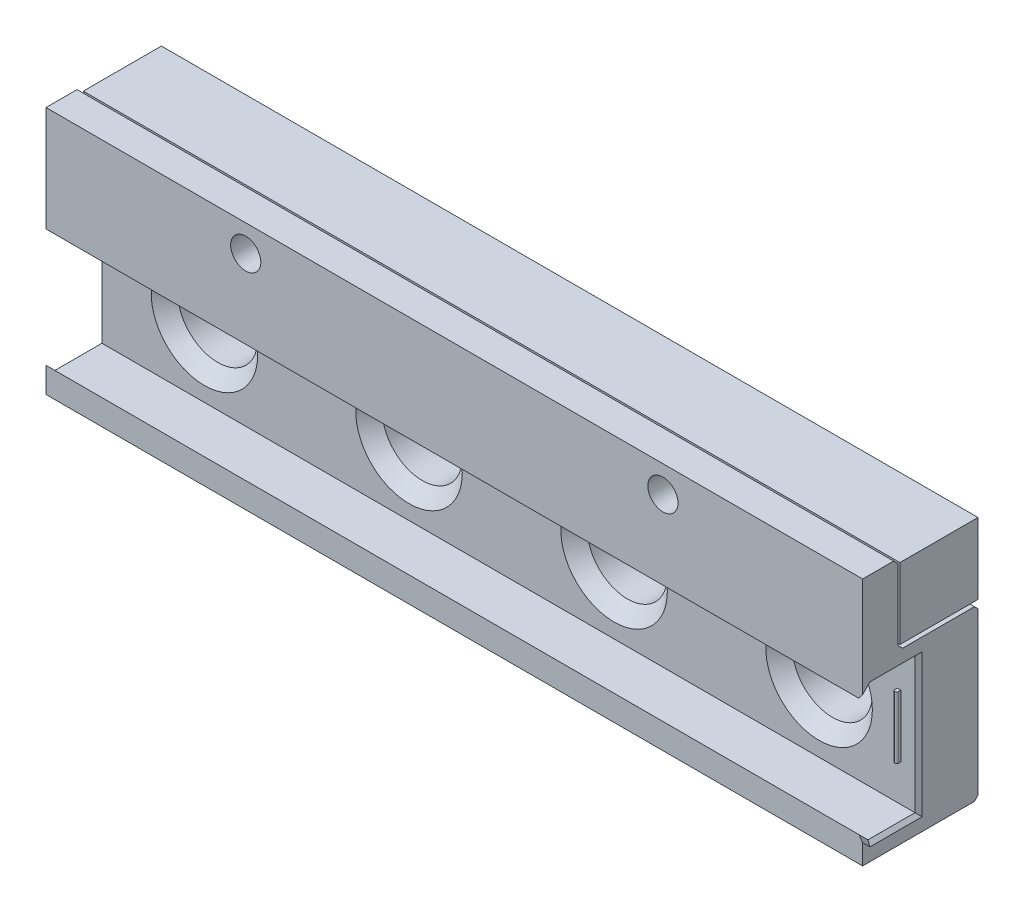
from build123d import *

# Parameters (mm, degrees)
SKETCH1_W            = 92
SKETCH1_H            = 19
BOSS_EXTRUDE1_DEPTH  = 13
SKETCH2_R            = 4.5
CUT_EXTRUDE1_DEPTH   = 68.498175317
SKETCH4_R            = 4.5
CUT_EXTRUDE2_DEPTH   = 68.498175317
SKETCH5_R            = 4.5
CUT_EXTRUDE3_DEPTH   = 68.498175317
SKETCH6_R            = 4.5
CUT_EXTRUDE4_DEPTH   = 68.498175317
SKETCH7_W            = 92
SKETCH7_H            = 15.3
CUT_EXTRUDE5_DEPTH   = 6.3
SKETCH11_W           = 92
SKETCH11_H           = 4
BOSS_EXTRUDE4_DEPTH  = 9
SKETCH12_R           = 1.7
CUT_EXTRUDE6_DEPTH   = 72.392868152
SKETCH13_R           = 1.7
CUT_EXTRUDE7_DEPTH   = 72.392868152
CHAMFER1_SIZE        = 0.4
CHAMFER2_SIZE        = 0.5
CHAMFER3_SIZE        = 0.5
CHAMFER4_SIZE        = 0.5
SKETCH14_W           = 92
SKETCH14_H           = 8
BOSS_EXTRUDE5_DEPTH  = 8.8
CHAMFER5_SIZE        = 1.5
BOSS_EXTRUDE8_DEPTH  = 92
CHAMFER6_SIZE        = 0.4
SKETCH20_W           = 0.4
SKETCH20_H           = 7
BOSS_EXTRUDE9_DEPTH  = 0.75
FILLET1_R            = 0.5
FILLET2_R            = 0.2
SKETCH25_W           = 90
SKETCH25_H           = 6
CUT_EXTRUDE10_DEPTH  = 1
SKETCH26_W           = 90
SKETCH26_H           = 6
CUT_EXTRUDE11_DEPTH  = 6.9
BOSS_EXTRUDE13_DEPTH = 1
BOSS_EXTRUDE14_DEPTH = 1
LPATTERN4_COUNT      = 22
LPATTERN4_PITCH      = 4.04
SKETCH30_W           = 1
SKETCH30_H           = 6
BOSS_EXTRUDE15_DEPTH = 6.9
LPATTERN5_COUNT      = 22
LPATTERN5_PITCH      = 4
SKETCH31_R           = 2.5
BOSS_EXTRUDE16_DEPTH = 1
SKETCH32_R           = 1.5
CUT_EXTRUDE12_DEPTH  = 1


with BuildPart() as part:
    # Sketch1 → Boss-Extrude1 (new body)
    with BuildSketch(Plane.XY):
        with Locations((-15.107228916, 16.052108434)):
            Rectangle(SKETCH1_W, SKETCH1_H)
    extrude(amount=BOSS_EXTRUDE1_DEPTH)

    # Sketch2 → Cut-Extrude1 (cut, through all)
    with BuildSketch(Plane.XY.offset(13)):
        with Locations((-49.557228916, 16.052108434)):
            Circle(SKETCH2_R)
    extrude(amount=-CUT_EXTRUDE1_DEPTH, mode=Mode.SUBTRACT)

    # Sketch4 → Cut-Extrude2 (cut, through all)
    with BuildSketch(Plane.XY.offset(13)):
        with Locations((-26.507228916, 16.052108434)):
            Circle(SKETCH4_R)
    extrude(amount=-CUT_EXTRUDE2_DEPTH, mode=Mode.SUBTRACT)

    # Sketch5 → Cut-Extrude3 (cut, through all)
    with BuildSketch(Plane.XY.offset(13)):
        with Locations((-3.407228916, 16.052108434)):
            Circle(SKETCH5_R)
    extrude(amount=-CUT_EXTRUDE3_DEPTH, mode=Mode.SUBTRACT)

    # Sketch6 → Cut-Extrude4 (cut, through all)
    with BuildSketch(Plane.XY.offset(13)):
        with Locations((19.692771084, 16.052108434)):
            Circle(SKETCH6_R)
    extrude(amount=-CUT_EXTRUDE4_DEPTH, mode=Mode.SUBTRACT)

    # Sketch7 → Cut-Extrude5 (cut)
    with BuildSketch(Plane.XY.offset(13)):
        with Locations((-15.107228916, 16.052108434)):
            Rectangle(SKETCH7_W, SKETCH7_H)
    extrude(amount=-CUT_EXTRUDE5_DEPTH, mode=Mode.SUBTRACT)

    # Sketch11 → Boss-Extrude4 (add)
    with BuildSketch(Plane(origin=(0, 25.552108434, 0), x_dir=(1, 0, 0), z_dir=(0, 1, 0))):
        with Locations((-15.107228916, -11)):
            Rectangle(SKETCH11_W, SKETCH11_H)
    extrude(amount=BOSS_EXTRUDE4_DEPTH)

    # Sketch12 → Cut-Extrude6 (cut, through all)
    with BuildSketch(Plane.XY.offset(13)):
        with Locations((-38.607228916, 31.552108434)):
            Circle(SKETCH12_R)
    extrude(amount=-CUT_EXTRUDE6_DEPTH, mode=Mode.SUBTRACT)

    # Sketch13 → Cut-Extrude7 (cut, through all)
    with BuildSketch(Plane.XY.offset(13)):
        with Locations((8.392771084, 31.552108434)):
            Circle(SKETCH13_R)
    extrude(amount=-CUT_EXTRUDE7_DEPTH, mode=Mode.SUBTRACT)

    # Chamfer1
    chamfer1_edges = [part.edges().sort_by_distance(p)[0] for p in [
        (-15.107228916, 25.552108434, 0),
        (-15.107228916, 6.552108434, 0),
    ]]
    chamfer(chamfer1_edges, length=CHAMFER1_SIZE)

    # Chamfer2
    chamfer2_edges = [part.edges().sort_by_distance(p)[0] for p in [
        (-40.307228916, 31.552108434, 9),
        (6.692771084, 31.552108434, 9),
    ]]
    chamfer(chamfer2_edges, length=CHAMFER2_SIZE)

    # Chamfer3
    chamfer3_edges = [part.edges().sort_by_distance(p)[0] for p in [
        (-15.107228916, 25.552108434, 9),
    ]]
    chamfer(chamfer3_edges, length=CHAMFER3_SIZE)

    # Chamfer4
    chamfer4_edges = [part.edges().sort_by_distance(p)[0] for p in [
        (-15.107228916, 34.552108434, 9),
    ]]
    chamfer(chamfer4_edges, length=CHAMFER4_SIZE)

    # Chamfer5
    chamfer5_edges = [part.edges().sort_by_distance(p)[0] for p in [
        (-54.057228916, 16.052108434, 6.7),
        (-31.007228916, 16.052108434, 6.7),
        (-7.907228916, 16.052108434, 6.7),
        (15.192771084, 16.052108434, 6.7),
    ]]
    chamfer(chamfer5_edges, length=CHAMFER5_SIZE)

    # Sketch19 → Boss-Extrude8 (add)
    with BuildSketch(Plane(origin=(30.892771084, 0, 0), x_dir=(0, 0, -1), z_dir=(1, 0, 0))):
        Polygon((-13, 23.702108434), (-12, 23.702108434), (-13, 22.702108434), align=None)
        Polygon((-13, 8.402108434), (-12, 8.402108434), (-13, 9.402108434), align=None)
    extrude(amount=-BOSS_EXTRUDE8_DEPTH)

    # Chamfer6
    chamfer6_edges = [part.edges().sort_by_distance(p)[0] for p in [
        (30.892771084, 23.202108434, 12.5),
        (30.892771084, 8.902108434, 12.5),
        (30.892771084, 16.052108434, 6.7),
        (30.892771084, 23.702108434, 9.35),
        (30.892771084, 8.402108434, 9.35),
    ]]
    chamfer(chamfer6_edges, length=CHAMFER6_SIZE)

    # Sketch20 → Boss-Extrude9 (add)
    with BuildSketch(Plane.XY.offset(6.7)):
        with Locations((28.692771084, 16.052108434)):
            Rectangle(SKETCH20_W, SKETCH20_H)
    extrude(amount=BOSS_EXTRUDE9_DEPTH)

    # Fillet1
    # the kernel refuses this fillet: 0.5 mm, written as the material it takes off along each edge
    with BuildSketch(Plane(origin=(28.492771084, 11.327363562, 7.45), x_dir=(0, 0, -1), z_dir=(0, 1, 0))) as fillet1_piece_1:
        with BuildLine():
            CenterArc((0.489897949, -0.5), FILLET1_R, 90, 78.463040967)
            Line((0, -0.4), (-0.009797959, -0.398))
            ThreePointArc((-0.009797959, -0.398), (-0.01, -0.2), (-0.01, 0))
            Line((-0.01, 0), (0, 0.01))
            Line((0, 0.01), (0.489897949, 0.01))
            Line((0.489897949, 0.01), (0.489897949, 0))
        make_face()
    extrude(amount=9.449489743, mode=Mode.SUBTRACT)

    # Fillet2
    # the kernel refuses this fillet: 0.2 mm, written as the material it takes off along each edge
    with BuildSketch(Plane(origin=(28.892771084, 21.133241026, 7.45), x_dir=(0, 0, -1), z_dir=(0, -1, 0))) as fillet2_piece_1:
        with BuildLine():
            CenterArc((0.48989602, -0.2), FILLET2_R, 90, 179.999631663)
            ThreePointArc((0.489894734, -0.4), (0.173668938, -0.287297318), (0, 0))
            Line((0, 0), (0.48989602, 0))
        make_face()
    extrude(amount=10.162265185, mode=Mode.SUBTRACT)


with BuildPart() as body_2:
    # Sketch14 → Boss-Extrude5 (new body)
    with BuildSketch(Plane(origin=(0, 0, 0), x_dir=(-1, 0, 0), z_dir=(0, 0, -1))):
        with Locations((15.107228916, 30.052108434)):
            Rectangle(SKETCH14_W, SKETCH14_H)
    extrude(amount=-BOSS_EXTRUDE5_DEPTH)

    # Sketch25 → Cut-Extrude10 (cut)
    with BuildSketch(Plane.XY.offset(8.8)):
        with Locations((-15.107228916, 30.052108434)):
            Rectangle(SKETCH25_W, SKETCH25_H)
    extrude(amount=-CUT_EXTRUDE10_DEPTH, mode=Mode.SUBTRACT)

    # Sketch26 → Cut-Extrude11 (cut)
    with BuildSketch(Plane(origin=(0, 0, 0), x_dir=(-1, 0, 0), z_dir=(0, 0, -1))):
        with Locations((15.107228916, 30.052108434)):
            Rectangle(SKETCH26_W, SKETCH26_H)
    extrude(amount=-CUT_EXTRUDE11_DEPTH, mode=Mode.SUBTRACT)

    # Sketch28 → Boss-Extrude13 (add)
    with BuildSketch(Plane.XY.offset(8.8)):
        Polygon((-60.107228916, 33.052108434), (-55.905983686, 27.052108434), (-54.905983686, 27.052108434), (-59.107228916, 33.052108434), align=None)
    boss_extrude13 = extrude(amount=-BOSS_EXTRUDE13_DEPTH)

    # Sketch29 → Boss-Extrude14 (add)
    with BuildSketch(Plane.XY.offset(8.8)):
        Polygon((-60.107228916, 27.052108434), (-59.107228916, 27.052108434), (-54.905983686, 33.052108434), (-55.905983686, 33.052108434), align=None)
    boss_extrude14 = extrude(amount=-BOSS_EXTRUDE14_DEPTH)

    # LPattern4: Boss-Extrude13, Boss-Extrude14 ×22
    with Locations(*[(i * LPATTERN4_PITCH, 0, 0) for i in range(1, LPATTERN4_COUNT)]):
        add(boss_extrude13)
        add(boss_extrude14)

    # Sketch30 → Boss-Extrude15 (add)
    with BuildSketch(Plane(origin=(0, 0, 0), x_dir=(-1, 0, 0), z_dir=(0, 0, -1))):
        with Locations((-26.392771084, 30.052108434)):
            Rectangle(SKETCH30_W, SKETCH30_H)
    boss_extrude15 = extrude(amount=-BOSS_EXTRUDE15_DEPTH)

    # LPattern5: Boss-Extrude15 ×22
    with Locations(*[(-i * LPATTERN5_PITCH, 0, 0) for i in range(1, LPATTERN5_COUNT)]):
        add(boss_extrude15)

    # Sketch31 → Boss-Extrude16 (add)
    with BuildSketch(Plane.XY.offset(8.8)):
        with Locations((8.392771084, 31.552108434)):
            Circle(SKETCH31_R)
        with Locations((-38.607228916, 31.552108434)):
            Circle(SKETCH31_R)
    extrude(amount=-BOSS_EXTRUDE16_DEPTH)

    # Sketch32 → Cut-Extrude12 (cut)
    with BuildSketch(Plane.XY.offset(8.8)):
        with Locations((-38.607228916, 31.552108434)):
            Circle(SKETCH32_R)
        with Locations((8.392771084, 31.552108434)):
            Circle(SKETCH32_R)
    extrude(amount=-CUT_EXTRUDE12_DEPTH, mode=Mode.SUBTRACT)


solid = Compound([part.part, body_2.part])
